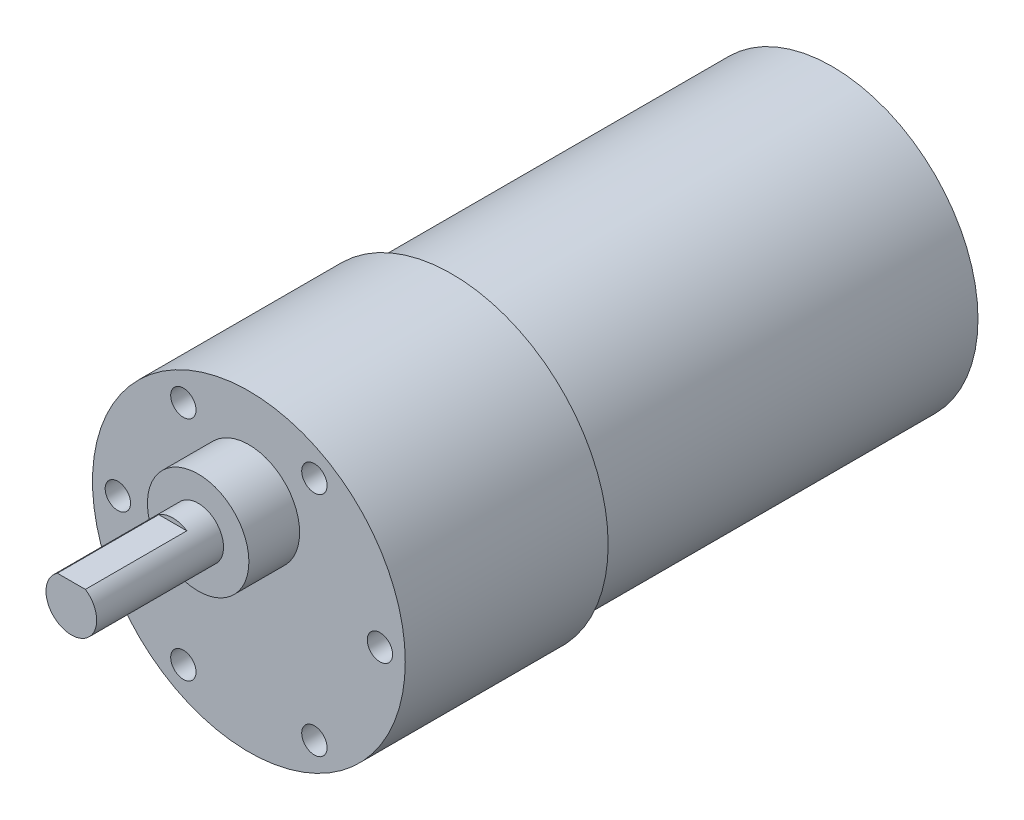
from build123d import *

# Parameters (mm, degrees)
SKETCH1_R           = 18.5
BOSS_EXTRUDE1_DEPTH = 24
SKETCH2_R           = 17.25
BOSS_EXTRUDE2_DEPTH = 45
SKETCH3_R           = 6
BOSS_EXTRUDE3_DEPTH = 6
SKETCH4_R           = 3
BOSS_EXTRUDE4_DEPTH = 15
CUT_EXTRUDE1_START  = -12
CUT_EXTRUDE1_DEPTH  = 12
SKETCH6_R           = 1.5
CUT_EXTRUDE2_DEPTH  = 3


with BuildPart() as part:
    # Sketch1 → Boss-Extrude1 (new body)
    with BuildSketch(Plane.XY):
        Circle(SKETCH1_R)
    extrude(amount=BOSS_EXTRUDE1_DEPTH)

    # Sketch2 → Boss-Extrude2 (add)
    with BuildSketch(Plane(origin=(0, 0, 0), x_dir=(-1, 0, 0), z_dir=(0, 0, -1))):
        Circle(SKETCH2_R)
    extrude(amount=BOSS_EXTRUDE2_DEPTH)

    # Sketch3 → Boss-Extrude3 (add)
    with BuildSketch(Plane.XY.offset(24)):
        with Locations((0, 7)):
            Circle(SKETCH3_R)
    extrude(amount=BOSS_EXTRUDE3_DEPTH)

    # Sketch4 → Boss-Extrude4 (add)
    with BuildSketch(Plane.XY.offset(30)):
        with Locations((0, 7)):
            Circle(SKETCH4_R)
    extrude(amount=BOSS_EXTRUDE4_DEPTH)

    # Sketch5 → Cut-Extrude1 (cut)
    with BuildSketch(Plane.XY.offset(45).offset(CUT_EXTRUDE1_START)):
        with BuildLine():
            ThreePointArc((1.658312395, 9.5), (0, 10), (-1.658312395, 9.5))
            Line((-1.658312395, 9.5), (0, 9.5))
            Line((0, 9.5), (1.658312395, 9.5))
        make_face()
    extrude(amount=CUT_EXTRUDE1_DEPTH, mode=Mode.SUBTRACT)

    # Sketch6 → Cut-Extrude2 (cut)
    with BuildSketch(Plane.XY.offset(24)):
        with Locations((7.75, 13.423393759)):
            Circle(SKETCH6_R)
        with Locations((15.5, 0)):
            Circle(SKETCH6_R)
        with Locations((7.75, -13.423393759)):
            Circle(SKETCH6_R)
        with Locations((-7.75, -13.423393759)):
            Circle(SKETCH6_R)
        with Locations((-15.5, 0)):
            Circle(SKETCH6_R)
        with Locations((-7.75, 13.423393759)):
            Circle(SKETCH6_R)
    extrude(amount=-CUT_EXTRUDE2_DEPTH, mode=Mode.SUBTRACT)


solid = part.part
